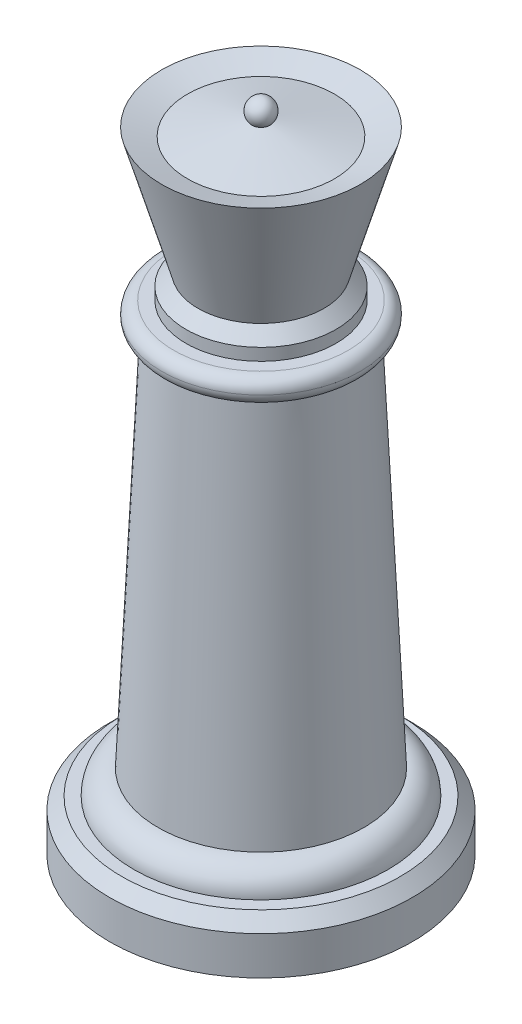
from build123d import *

# Parameters (mm, degrees)
CHAMFER1_SIZE = 0.03
FILLET1_R     = 0.06
FILLET2_R     = 0.03


# Read off the part's stored shape, not the designer's step: Scale1
with BuildPart() as part:
    # Sketch1 → Revolve1 (revolve)
    with BuildSketch(Plane.XY, mode=Mode.PRIVATE) as revolve1_sk:
        with BuildLine():
            Line((0, 0), (-0.375, 0))
            Line((-0.375, 0), (-0.375, 0.125))
            Line((-0.375, 0.125), (-0.315, 0.125))
            Line((-0.315, 0.125), (-0.315, 0.185))
            Line((-0.315, 0.185), (-0.255, 0.185))
            Line((-0.255, 0.185), (-0.212, 1.129))
            Line((-0.212, 1.129), (-0.246, 1.129))
            Line((-0.246, 1.129), (-0.246, 1.189))
            Line((-0.246, 1.189), (-0.186, 1.189))
            Line((-0.186, 1.189), (-0.186, 1.249))
            Line((-0.186, 1.249), (-0.156, 1.249))
            Line((-0.156, 1.249), (-0.246, 1.56))
            Line((-0.246, 1.56), (-0.182, 1.54))
            Line((-0.182, 1.54), (-0.022424467, 1.575071546))
            ThreePointArc((-0.022424467, 1.575071546), (-0.027366527, 1.607291183), (0, 1.625))
            Line((0, 1.625), (0, 0))
        make_face()
    revolve(revolve1_sk.sketch.rotate(Axis((0, 0, 0), (0, 1, 0)), 270), axis=Axis((0, 0, 0), (0, 1, 0)))

    # Chamfer1
    chamfer1_edges = [part.edges().sort_by_distance(p)[0] for p in [
        (0, 0.125, 0.375),
        (0, 1.249, 0.186),
    ]]
    chamfer(chamfer1_edges, length=CHAMFER1_SIZE - 0.0001)  # a hair under: the kernel refuses the full size

    # Fillet1
    fillet1_edges = [part.edges().sort_by_distance(p)[0] for p in [
        (0, 0.185, 0.315),
    ]]
    fillet(fillet1_edges, radius=FILLET1_R - 0.0001)  # a hair under: the kernel refuses the full size

    # Fillet2
    fillet2_edges = [part.edges().sort_by_distance(p)[0] for p in [
        (0, 1.129, 0.246),
        (0, 1.189, 0.246),
    ]]
    fillet(fillet2_edges, radius=FILLET2_R - 0.0001)  # a hair under: the kernel refuses the full size

    # Scale1 outline → Scale1 (revolve)
    with BuildSketch(Plane.XY):
        with BuildLine():
            Line((5.46, 27.865595941), (0.672734004, 28.917742313))
            ThreePointArc((0.672734004, 28.917742313), (0.820995818, 29.884331439), (0, 30.415595941))
            Line((0, 30.415595941), (0, 1.625))
            ThreePointArc((0, 1.625), (0.027366527, 1.607291183), (0.022424467, 1.575071546))
            Line((0.022424467, 1.575071546), (0.182, 1.54))
            Line((0.182, 1.54), (0.246, 1.56))
            Line((0.246, 1.56), (0.156, 1.249))
            Line((0.156, 1.249), (0.186, 1.219))
            Line((0.186, 1.219), (0.186, 1.189))
            Line((0.186, 1.189), (0.216, 1.189))
            ThreePointArc((0.216, 1.189), (0.237213203, 1.180213203), (0.246, 1.159))
            ThreePointArc((0.246, 1.159), (0.237213203, 1.137786797), (0.216, 1.129))
            Line((0.216, 1.129), (0.212, 1.129))
            Line((0.212, 1.129), (0.255, 0.185))
            ThreePointArc((0.255, 0.185), (0.297426407, 0.167426407), (0.315, 0.125))
            Line((0.315, 0.125), (0.345, 0.125))
            Line((0.345, 0.125), (0.375, 0.095))
            Line((0.375, 0.095), (0.375, 0))
            Line((0.375, 0), (0, 0))
            Line((0, 0), (0, -18.334404059))
            Line((0, -18.334404059), (11.25, -18.334404059))
            Line((11.25, -18.334404059), (11.25, -15.484404059))
            Line((11.25, -15.484404059), (10.35, -14.584404059))
            Line((10.35, -14.584404059), (9.45, -14.584404059))
            ThreePointArc((9.45, -14.584404059), (8.922792206, -13.311611853), (7.65, -12.784404059))
            Line((7.65, -12.784404059), (6.36, 15.535595941))
            Line((6.36, 15.535595941), (6.48, 15.535595941))
            ThreePointArc((6.48, 15.535595941), (7.116396103, 15.799199838), (7.38, 16.435595941))
            ThreePointArc((7.38, 16.435595941), (7.116396103, 17.071992044), (6.48, 17.335595941))
            Line((6.48, 17.335595941), (5.58, 17.335595941))
            Line((5.58, 17.335595941), (5.58, 18.235595941))
            Line((5.58, 18.235595941), (4.68, 19.135595941))
            Line((4.68, 19.135595941), (7.38, 28.465595941))
            Line((7.38, 28.465595941), (5.46, 27.865595941))
        make_face()
    revolve(axis=Axis((0, 0, 0), (0, 1, 0)))


solid = part.part
